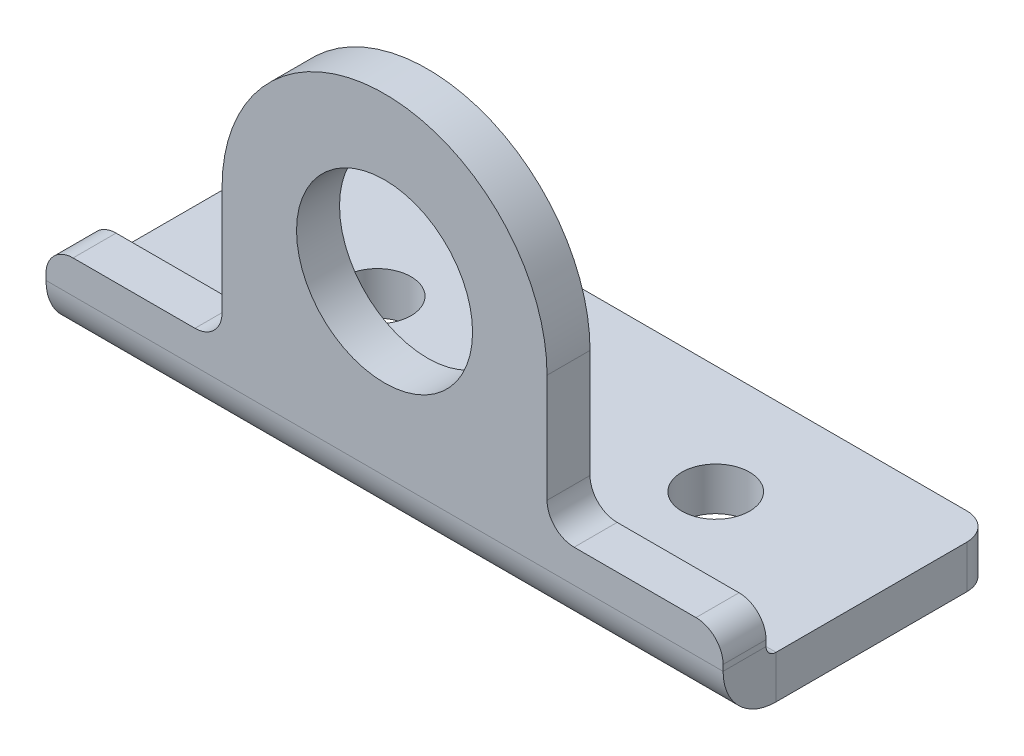
from build123d import *

# Parameters (mm, degrees)
SKETCH1_R                    = 6.5
BASE_FLANGE1_DEPTH           = 3.175
EDGE_FLANGE1_STRIP_W         = 14.1732
EDGE_FLANGE1_STRIP_H         = 3.175
EDGE_FLANGE1_STRIP_CUT_DEPTH = 50
EDGE_FLANGE1_DEPTH           = 50
FILLET2_R                    = 2
F_5_0MM_DOWEL_HOLE1_D        = 5


# Sheet-metal steps are written as plain solids
with BuildPart() as part:
    # Sketch1 → Base-Flange1 (new body)
    with BuildSketch(Plane.XY):
        with BuildLine():
            Line((-25, 0), (25, 0))
            Line((25, 0), (25, 1.175))
            ThreePointArc((25, 1.175), (24.414213562, 2.589213562), (23, 3.175))
            Line((23, 3.175), (14, 3.175))
            ThreePointArc((14, 3.175), (12.585786438, 3.760786438), (12, 5.175))
            Line((12, 5.175), (12, 13.175))
            ThreePointArc((12, 13.175), (0, 25.175), (-12, 13.175))
            Line((-12, 13.175), (-12, 5.175))
            ThreePointArc((-12, 5.175), (-12.585786438, 3.760786438), (-14, 3.175))
            Line((-14, 3.175), (-23, 3.175))
            ThreePointArc((-23, 3.175), (-24.414213562, 2.589213562), (-25, 1.175))
            Line((-25, 1.175), (-25, 0))
        make_face()
        with Locations((0, 13.175)):
            Circle(SKETCH1_R, mode=Mode.SUBTRACT)
    extrude(amount=-BASE_FLANGE1_DEPTH)

    # Edge-Flange1 strip (across the edge) → Edge-Flange1 strip cut (cut)
    with BuildSketch(Plane(origin=(25, 0, -3.175), x_dir=(0, 1, 0), z_dir=(-1, 0, 0))):
        with Locations((-6.35, -1.5875)):
            Rectangle(EDGE_FLANGE1_STRIP_W, EDGE_FLANGE1_STRIP_H)
    extrude(amount=EDGE_FLANGE1_STRIP_CUT_DEPTH, mode=Mode.SUBTRACT)

    # Edge-Flange1 section (across the edge) → Edge-Flange1 (add)
    with BuildSketch(Plane(origin=(25, 0, -3.175), x_dir=(0, 1, 0), z_dir=(-1, 0, 0))):
        with BuildLine():
            Line((-3.175, 0.7366), (-3.175, 16.825))
            Line((-3.175, 16.825), (0, 16.825))
            Line((0, 16.825), (0, 0.7366))
            ThreePointArc((0, 0.7366), (0.215745145, 0.215745145), (0.7366, 0))
            Line((0.7366, 0), (0.7366, -3.175))
            ThreePointArc((0.7366, -3.175), (-2.029318885, -2.029318885), (-3.175, 0.7366))
        make_face()
    extrude(amount=EDGE_FLANGE1_DEPTH)

    # Fillet2
    fillet2_edges = [part.edges().sort_by_distance(p)[0] for p in [
        (25, -1.5875, -20),
        (-25, -1.5875, -20),
    ]]
    fillet(fillet2_edges, radius=FILLET2_R)

    # Ø5.0mm Dowel Hole1 (through all)
    with Locations(Plane(origin=(0, 0, 0), x_dir=(1, 0, 0), z_dir=(0, 1, 0))):
        with Locations((-12.5, 11.9558), (12.5, 11.9558)):
            Hole(F_5_0MM_DOWEL_HOLE1_D / 2)


solid = part.part
